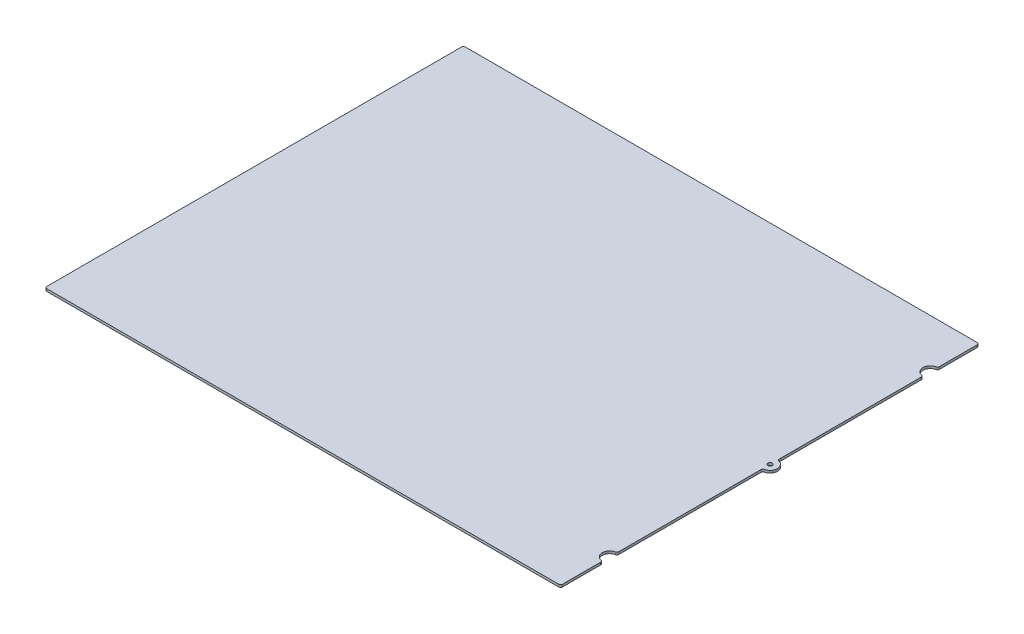
from build123d import *

# Parameters (mm, degrees)
BOSS_EXTRUDE1_DEPTH        = 3.175
F_1_0_228_DIAMETER_HOLE2_D = 5.7912
FILLET2_R                  = 2.54


with BuildPart() as part:
    # Sketch1 → Boss-Extrude1 (new body)
    with BuildSketch(Plane(origin=(0, 0, 0), x_dir=(1, 0, 0), z_dir=(0, 1, 0))):
        with BuildLine():
            Line((337.058, 219.456), (337.058, 273.558))
            Line((337.058, 273.558), (-337.058, 273.558))
            Line((-337.058, 273.558), (-337.058, -273.558))
            Line((-337.058, -273.558), (337.058, -273.558))
            Line((337.058, -273.558), (337.058, -218.948))
            ThreePointArc((337.058, -218.948), (327.406, -209.296), (337.058, -199.644))
            Line((337.058, -199.644), (337.058, -9.398))
            ThreePointArc((337.058, -9.398), (346.71, 0.254), (337.058, 9.906))
            Line((337.058, 9.906), (337.058, 200.152))
            ThreePointArc((337.058, 200.152), (327.406, 209.804), (337.058, 219.456))
        make_face()
    extrude(amount=BOSS_EXTRUDE1_DEPTH)

    # #1 (0.228) Diameter Hole2 (through all)
    with Locations(Plane(origin=(0, 3.175, 0), x_dir=(1, 0, 0), z_dir=(0, 1, 0))):
        with Locations((337.058, 0.254)):
            Hole(F_1_0_228_DIAMETER_HOLE2_D / 2)

    # Fillet2
    fillet2_edges = [part.edges().sort_by_distance(p)[0] for p in [
        (-337.058, 1.5875, -273.558),
        (-337.058, 1.5875, 273.558),
        (337.058, 1.5875, 273.558),
        (337.058, 1.5875, 218.948),
        (337.058, 1.5875, 199.644),
        (337.058, 1.5875, 9.398),
        (337.058, 1.5875, -9.906),
        (337.058, 1.5875, -200.152),
        (337.058, 1.5875, -219.456),
        (337.058, 1.5875, -273.558),
    ]]
    fillet(fillet2_edges, radius=FILLET2_R)


solid = part.part
